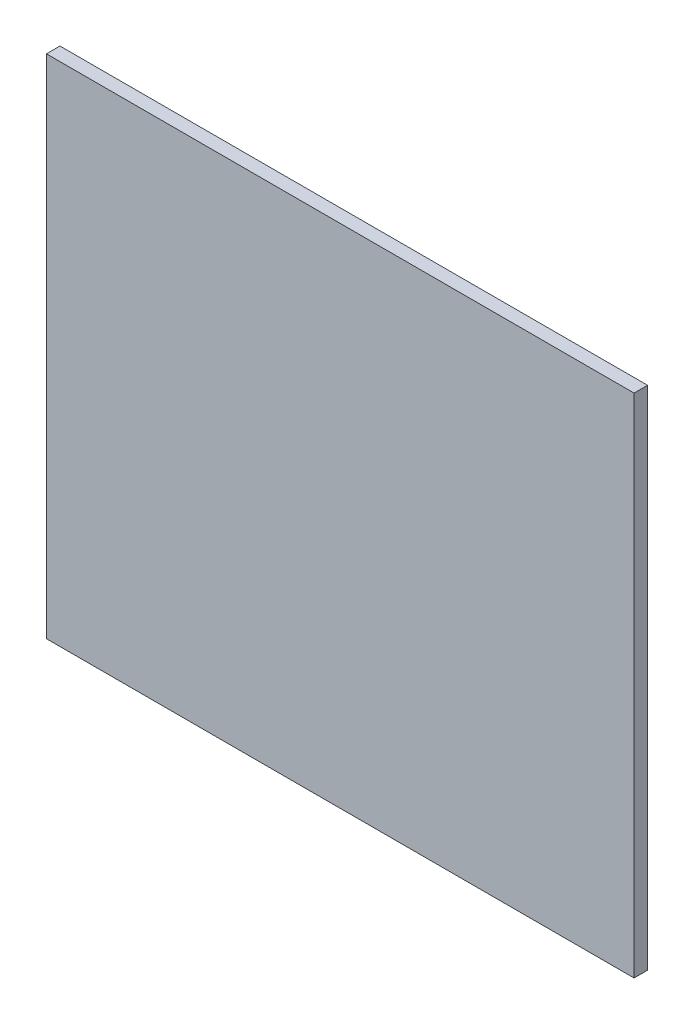
from build123d import *

# Parameters (mm, degrees)
ESQUISSE1_W        = 87
ESQUISSE1_H        = 75
BOSS_EXTRU_1_DEPTH = 2
ESQUISSE2_W        = 5
ESQUISSE2_H        = 6.5
BOSS_EXTRU_2_DEPTH = 5
ESQUISSE3_W        = 10
ESQUISSE3_H        = 20
BOSS_EXTRU_3_DEPTH = 10


with BuildPart() as part:
    # Esquisse1 → Boss.-Extru.1 (new body)
    with BuildSketch(Plane.XY):
        with Locations((10.327168808, -6.216535433)):
            Rectangle(ESQUISSE1_W, ESQUISSE1_H)
    extrude(amount=BOSS_EXTRU_1_DEPTH)

    # Esquisse2 → Boss.-Extru.2 (add)
    with BuildSketch(Plane(origin=(0, 0, 0), x_dir=(-1, 0, 0), z_dir=(0, 0, -1))):
        with Locations((30.672831192, -6.216535433)):
            Rectangle(ESQUISSE2_W, ESQUISSE2_H)
    extrude(amount=BOSS_EXTRU_2_DEPTH)

    # Esquisse3 → Boss.-Extru.3 (add)
    with BuildSketch(Plane(origin=(0, 0, -5), x_dir=(-1, 0, 0), z_dir=(0, 0, -1))):
        with Locations((28.172831192, -6.216535433)):
            Rectangle(ESQUISSE3_W, ESQUISSE3_H)
    extrude(amount=BOSS_EXTRU_3_DEPTH)


solid = part.part
